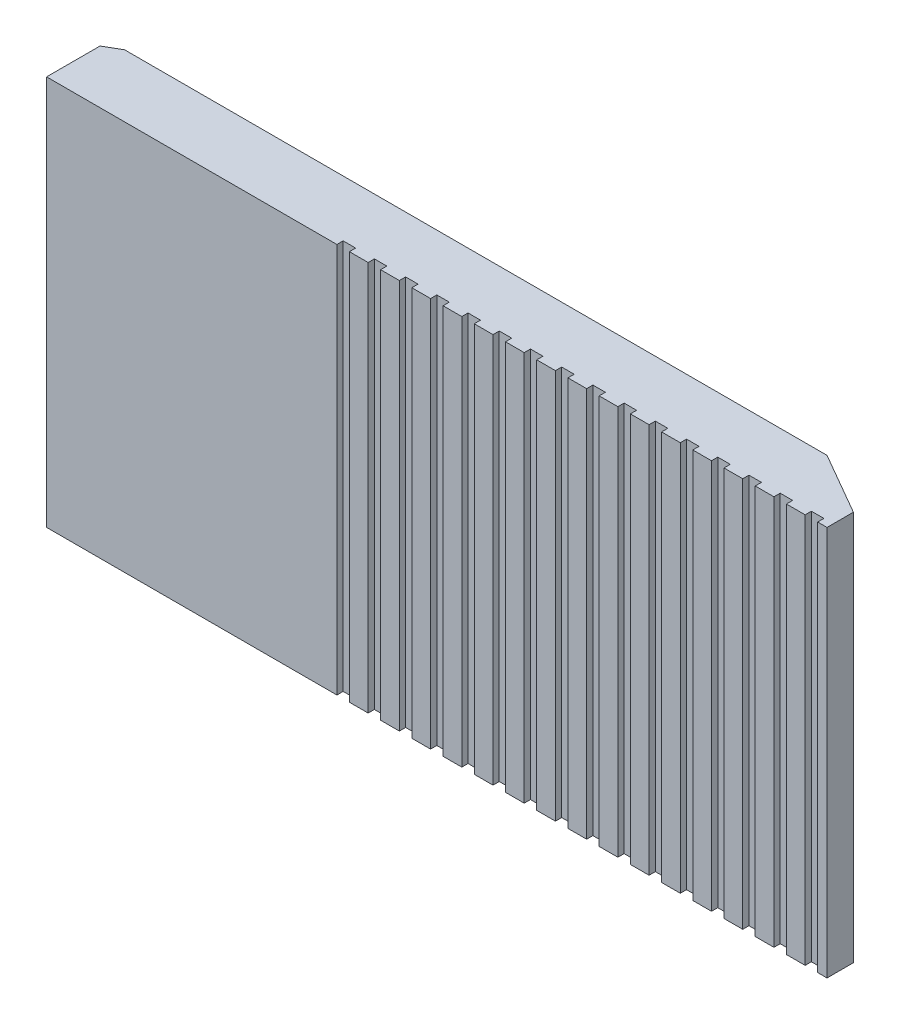
from build123d import *

# Parameters (mm, degrees)
SZKIC1_W                    = 50
SZKIC1_H                    = 25
DODANIE_WYCI_GNI_CIE1_DEPTH = 4
SFAZOWANIE1_SIZE            = 4
SFAZOWANIE1_SIZE2           = 2.309401077
SZKIC2_W                    = 10
SZKIC2_H                    = 10
DODANIE_WYCI_GNI_CIE2_DEPTH = 5.5
WYTNIJ_WYCI_GNI_CIE1_REACH  = 37.781
SZKIC3_W                    = 0.8
SZKIC3_H                    = 0.8
SZYK_LINIOWY1_COUNT         = 16
SZYK_LINIOWY1_PITCH         = 2
SFAZOWANIE2_SIZE            = 1
SFAZOWANIE2_SIZE2           = 0.577350269


with BuildPart() as part:
    # Szkic1 → Dodanie-wyciągnięcie1 (new body)
    with BuildSketch(Plane.XY):
        Rectangle(SZKIC1_W, SZKIC1_H)
    extrude(amount=DODANIE_WYCI_GNI_CIE1_DEPTH)

    # Sfazowanie1
    sfazowanie1_edges = [part.edges().sort_by_distance(p)[0] for p in [
        (25, 0, 0),
    ]]
    sfazowanie1_side = [part.faces().sort_by_distance(p)[0] for p in [
        (0, 0, 0),
    ]]
    chamfer(sfazowanie1_edges, length=SFAZOWANIE1_SIZE, length2=SFAZOWANIE1_SIZE2, reference=sfazowanie1_side[0])

    # Szkic2 → Dodanie-wyciągnięcie2 (add)
    with BuildSketch(Plane(origin=(0, 0, 0), x_dir=(-1, 0, 0), z_dir=(0, 0, -1))):
        with Locations((-10, 0)):
            Rectangle(SZKIC2_W, SZKIC2_H)
    extrude(amount=DODANIE_WYCI_GNI_CIE2_DEPTH)

    # Szkic3 → Wytnij-wyciągnięcie1 (cut, up to next)
    with BuildSketch(Plane(origin=(0, 12.5, 0), x_dir=(1, 0, 0), z_dir=(0, 1, 0)), mode=Mode.PRIVATE) as wytnij_wyci_gni_cie1_sk1:
        with Locations((24, -4)):
            Rectangle(SZKIC3_W, SZKIC3_H)
    wytnij_wyci_gni_cie1_tool1 = extrude(wytnij_wyci_gni_cie1_sk1.sketch, amount=-WYTNIJ_WYCI_GNI_CIE1_REACH, mode=Mode.PRIVATE) & part.part
    wytnij_wyci_gni_cie1 = wytnij_wyci_gni_cie1_tool1.solids().sort_by_distance((24, 12.5, 4))[0]
    add(wytnij_wyci_gni_cie1, mode=Mode.SUBTRACT)

    # Szyk liniowy1: Wytnij-wyciągnięcie1 ×16
    with Locations(*[(-i * SZYK_LINIOWY1_PITCH, 0, 0) for i in range(1, SZYK_LINIOWY1_COUNT)]):
        add(wytnij_wyci_gni_cie1, mode=Mode.SUBTRACT)

    # Sfazowanie2
    sfazowanie2_edges = [part.edges().sort_by_distance(p)[0] for p in [
        (-25, 0, 0),
    ]]
    sfazowanie2_side = [part.faces().sort_by_distance(p)[0] for p in [
        (-3.142857143, 0, 0),
    ]]
    chamfer(sfazowanie2_edges, length=SFAZOWANIE2_SIZE, length2=SFAZOWANIE2_SIZE2, reference=sfazowanie2_side[0])


solid = part.part
